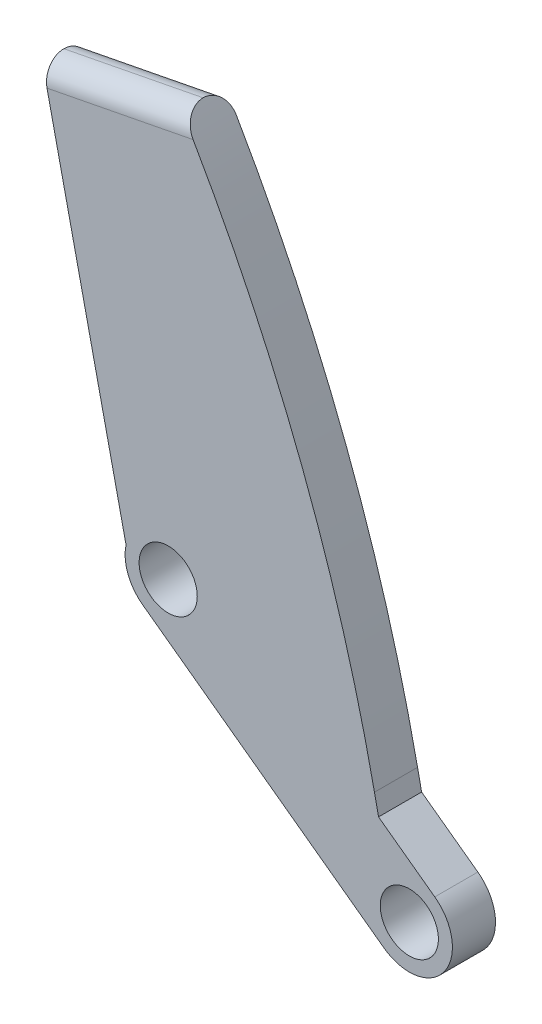
from build123d import *

# Parameters (mm, degrees)
SKETCH1_R           = 2.7
BOSS_EXTRUDE1_DEPTH = 4
BOSS_EXTRUDE2_DEPTH = 4
FILLET4_R           = 150
FILLET5_R           = 2


# Some blends are built 0.0001 mm under size
with BuildPart() as part:
    # Sketch1 → Boss-Extrude1 (new body)
    with BuildSketch(Plane.XY):
        with BuildLine():
            Line((-24.747899147, 13.14945447), (-2.361821958, -3.228280818))
            ThreePointArc((-2.361821958, -3.228280818), (3.228280818, -2.361821958), (2.361821958, 3.228280818))
            Line((2.361821958, 3.228280818), (-20.024255231, 19.606016105))
            ThreePointArc((-20.024255231, 19.606016105), (-25.614358007, 18.739557246), (-24.747899147, 13.14945447))
        make_face()
        Circle(SKETCH1_R, mode=Mode.SUBTRACT)
        with Locations((-22.386077189, 16.377735287)):
            Circle(SKETCH1_R, mode=Mode.SUBTRACT)
    extrude(amount=BOSS_EXTRUDE1_DEPTH)

    # Sketch2 → Boss-Extrude2 (add, through all)
    with BuildSketch(Plane.XY.offset(4)):
        with BuildLine():
            Line((-26.299706155, 17.204480908), (-34.069064165, 52.206086792))
            Line((-34.069064165, 52.206086792), (-21.14349971, 54.723244673))
            Line((-21.14349971, 54.723244673), (-13.231740333, 56.386597335))
            Line((-13.231740333, 56.386597335), (-2.8588348, 7.047732243))
            Line((-2.8588348, 7.047732243), (-13.354395565, 14.726322576))
            Line((-13.354395565, 14.726322576), (-20.024255231, 19.606016105))
            ThreePointArc((-20.024255231, 19.606016105), (-23.81571668, 20.113525823), (-26.299706155, 17.204480908))
        make_face()
    extrude(amount=-BOSS_EXTRUDE2_DEPTH)

    # Fillet4
    # the kernel refuses this fillet: 150 mm, written as the material it takes off along each edge
    with BuildSketch(Plane(origin=(-13.231740333, 56.386597335, 125.450940965), x_dir=(0.20574032293470337, -0.9786066214361745, 0), z_dir=(0, 0, -1))) as fillet4_piece_1:
        with BuildLine():
            CenterArc((48.580376386, 150), FILLET4_R, 251.102921571, 18.897078429)
            Line((0, 8.084718828), (0, 0))
            Line((0, 0), (48.580376386, 0))
        make_face()
    extrude(amount=246.90188193, mode=Mode.SUBTRACT)

    # Fillet5
    fillet5_edges = [part.edges().sort_by_distance(p)[0] for p in [
        (-27.606281937, 53.464665733, 4),
        (-27.606281937, 53.464665733, 0),
    ]]
    fillet(fillet5_edges, radius=FILLET5_R - 0.0001)  # a hair under: the kernel refuses the full size


solid = part.part
